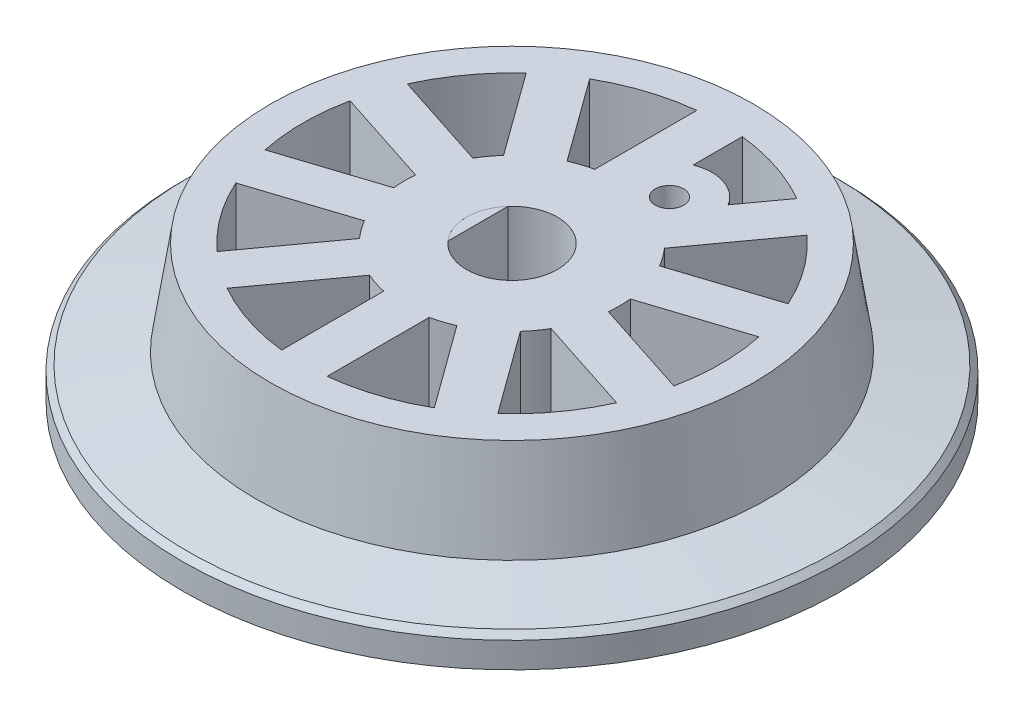
from build123d import *

# Parameters (mm, degrees)
SKETCH_4_R               = 11.6
SKETCH_4_R_2             = 1.6
EXTRUDE_1_DEPTH          = 1.1
EXTRUDE_START            = 1.5
SKETCH_4_3_R             = 9
SKETCH_4_3_R_2           = 1.6
EXTRUDE_2_DEPTH          = 3.3
CHAMFER_1_SIZE           = 0.2
SKETCH_4_4_R             = 1.6
CUT_EXTRUDE_2_DEPTH      = 18.092688495
CHAMFER_2_SIZE           = 0.5
CHAMFER_2_SIZE_2         = 3.3
CUT_EXTRUDE_4_DEPTH      = 18.092688495
EXTRUDE_3_DEPTH          = 4.8
PATTERN_CIRCULAR_2_COUNT = 10
SKETCH_6_R               = 1.5
EXTRUDE_4_DEPTH          = 4.8
SKETCH_6_3_R             = 0.5
CUT_EXTRUDE_5_DEPTH      = 18.092688495
EXTRUDE_5_DEPTH          = 4.8


with BuildPart() as part:
    # 草图4 → 凸台-拉伸1 (new body)
    with BuildSketch(Plane(origin=(0, 0, 0), x_dir=(1, 0, 0), z_dir=(0, 1, 0))):
        with Locations(Location((0, 0, 0), (0, 0, 270))):
            Circle(SKETCH_4_R)
        with Locations(Location((0, 0, 0), (0, 0, 270))):
            Circle(SKETCH_4_R_2, mode=Mode.SUBTRACT)
    extrude(amount=EXTRUDE_1_DEPTH)

    # 倒角1
    chamfer_1_edges = [part.edges().sort_by_distance(p)[0] for p in [
        (0, 1.1, -11.6),
    ]]
    chamfer(chamfer_1_edges, length=CHAMFER_1_SIZE)


with BuildPart() as body_2:
    # 草图4<3> → 凸台-拉伸2 (new body)
    with BuildSketch(Plane(origin=(0, 0, 0), x_dir=(1, 0, 0), z_dir=(0, 1, 0)).offset(EXTRUDE_START)):
        with Locations(Location((0, 0, 0), (0, 0, 270))):
            Circle(SKETCH_4_3_R)
        with Locations(Location((0, 0, 0), (0, 0, 270))):
            Circle(SKETCH_4_3_R_2, mode=Mode.SUBTRACT)
    extrude(amount=EXTRUDE_2_DEPTH)


    add(part.part)  # loft_1 joins it to this body
    # loft up to a face of the part (loft_1)
    loft([Face(Wire([body_2.edges().sort_by_distance((-6.560717647, 1.5, -6.160923953))[0]])), Face(Wire([body_2.edges().sort_by_distance((8.310242353, 1.1, -7.803837008))[0]]))])

    # 草图4<4> → 切除-拉伸2 (cut, through all)
    with BuildSketch(Plane(origin=(0, 0, 0), x_dir=(1, 0, 0), z_dir=(0, 1, 0))):
        with Locations(Location((0, 0, 0), (0, 0, 270))):
            Circle(SKETCH_4_4_R)
    extrude(amount=CUT_EXTRUDE_2_DEPTH, mode=Mode.SUBTRACT)

    # 倒角2
    # the kernel refuses this chamfer: 3.3, 0.5 mm, written as the material it takes off along each edge
    with BuildSketch(Plane(origin=(0, 4.8, 0), x_dir=(0, 0, 1), z_dir=(-1, 0, 0))) as chamfer_2_piece_1:
        Polygon((9 - CHAMFER_2_SIZE, 0), (9, -CHAMFER_2_SIZE_2), (9, 0), align=None)
    revolve(axis=Axis((0, 4.8, 0), (0, 1, 0)), mode=Mode.SUBTRACT)

    # 草图5 → 切除-拉伸4 (cut, through all)
    with BuildSketch(Plane(origin=(0, 4.8, 0), x_dir=(1, 0, 0), z_dir=(0, 1, 0))):
        with BuildLine():
            ThreePointArc((3.8, 0), (-2.387467277, -2.9563491), (-0.8, 3.714835124))
            Line((-0.8, 3.714835124), (-0.8, 7.30633287))
            ThreePointArc((-0.8, 7.30633287), (-4.906246019, -5.47277352), (7.35, 0))
            ThreePointArc((7.35, 0), (5.47277352, 4.906246019), (0.8, 7.30633287))
            Line((0.8, 7.30633287), (0.8, 3.714835124))
            ThreePointArc((0.8, 3.714835124), (2.9563491, 2.387467277), (3.8, 0))
        make_face()
        with BuildLine():
            Line((-0.8, 7.30633287), (-0.8, 3.714835124))
            ThreePointArc((-0.8, 3.714835124), (-0.402260194, 3.778648798), (0, 3.8))
            Line((0, 3.8), (0, 7.35))
            ThreePointArc((0, 7.35), (-0.400595438, 7.339075098), (-0.8, 7.30633287))
        make_face()
        with BuildLine():
            Line((0, 7.35), (0, 3.8))
            ThreePointArc((0, 3.8), (0.402260194, 3.778648798), (0.8, 3.714835124))
            Line((0.8, 3.714835124), (0.8, 7.30633287))
            ThreePointArc((0.8, 7.30633287), (0.400595438, 7.339075098), (0, 7.35))
        make_face()
    extrude(amount=-CUT_EXTRUDE_4_DEPTH, mode=Mode.SUBTRACT)


with BuildPart() as cut_extrude_4_piece_1:
    # of the separate pieces the step leaves, piece 1, a body of its own (cut_extrude_4_pieces)
    add(body_2.part.solids().sort_by_distance((0, 0.9, 11.6))[0])

    # 草图5<4> → 凸台-拉伸3 (add)
    with BuildSketch(Plane(origin=(0, 4.8, 0), x_dir=(1, 0, 0), z_dir=(0, 1, 0))):
        with BuildLine():
            Line((0, 7.35), (0, 3.8))
            ThreePointArc((0, 3.8), (0.402260194, 3.778648798), (0.8, 3.714835124))
            Line((0.8, 3.714835124), (0.8, 7.30633287))
            ThreePointArc((0.8, 7.30633287), (0.400595438, 7.339075098), (0, 7.35))
        make_face()
        with BuildLine():
            Line((-0.8, 7.30633287), (-0.8, 3.714835124))
            ThreePointArc((-0.8, 3.714835124), (-0.402260194, 3.778648798), (0, 3.8))
            Line((0, 3.8), (0, 7.35))
            ThreePointArc((0, 7.35), (-0.400595438, 7.339075098), (-0.8, 7.30633287))
        make_face()
    extrude_3 = extrude(amount=-EXTRUDE_3_DEPTH)

    # 阵列(圆周)2: 凸台-拉伸3 ×10 about axis
    pattern_circular_2_axis = Axis((0, 0, 0), (0, 1, 0))
    for i in range(1, PATTERN_CIRCULAR_2_COUNT):
        add(extrude_3.rotate(pattern_circular_2_axis, i * 360 / PATTERN_CIRCULAR_2_COUNT))



with BuildPart() as cut_extrude_4_piece_2:
    # of the separate pieces the step leaves, piece 2, a body of its own (cut_extrude_4_pieces)
    add(body_2.part.solids().sort_by_distance((-0.8, 0, -3.714835124))[0])


with BuildPart() as cut_extrude_4_piece_1_1:
    add(cut_extrude_4_piece_1.part)

    add(cut_extrude_4_piece_2.part)  # 凸台-拉伸4 merges 切除-拉伸4 piece 2
    # 草图6 → 凸台-拉伸4 (add, through all)
    with BuildSketch(Plane(origin=(0, 4.8, 0), x_dir=(1, 0, 0), z_dir=(0, 1, 0))):
        with Locations((1.359674775, 4.184648672)):
            Circle(SKETCH_6_R)
    extrude(amount=-EXTRUDE_4_DEPTH)

    # 草图6<3> → 切除-拉伸5 (cut, through all)
    with BuildSketch(Plane(origin=(0, 4.8, 0), x_dir=(1, 0, 0), z_dir=(0, 1, 0))):
        with Locations(Location((1.359674775, 4.184648672, 0), (0, 0, 270))):
            Circle(SKETCH_6_3_R)
    extrude(amount=-CUT_EXTRUDE_5_DEPTH, mode=Mode.SUBTRACT)


with BuildPart() as body_2_2:
    # 草图4<6> → 凸台-拉伸5 (new body)
    with BuildSketch(Plane(origin=(0, 0, 0), x_dir=(1, 0, 0), z_dir=(0, 1, 0))):
        with BuildLine():
            Line((-1.2, -1.058300524), (-1.2, 1.058300524))
            ThreePointArc((-1.2, 1.058300524), (-1.6, 0), (-1.2, -1.058300524))
        make_face()
    extrude(amount=EXTRUDE_5_DEPTH)


solid = Compound([cut_extrude_4_piece_1_1.part, body_2_2.part])
